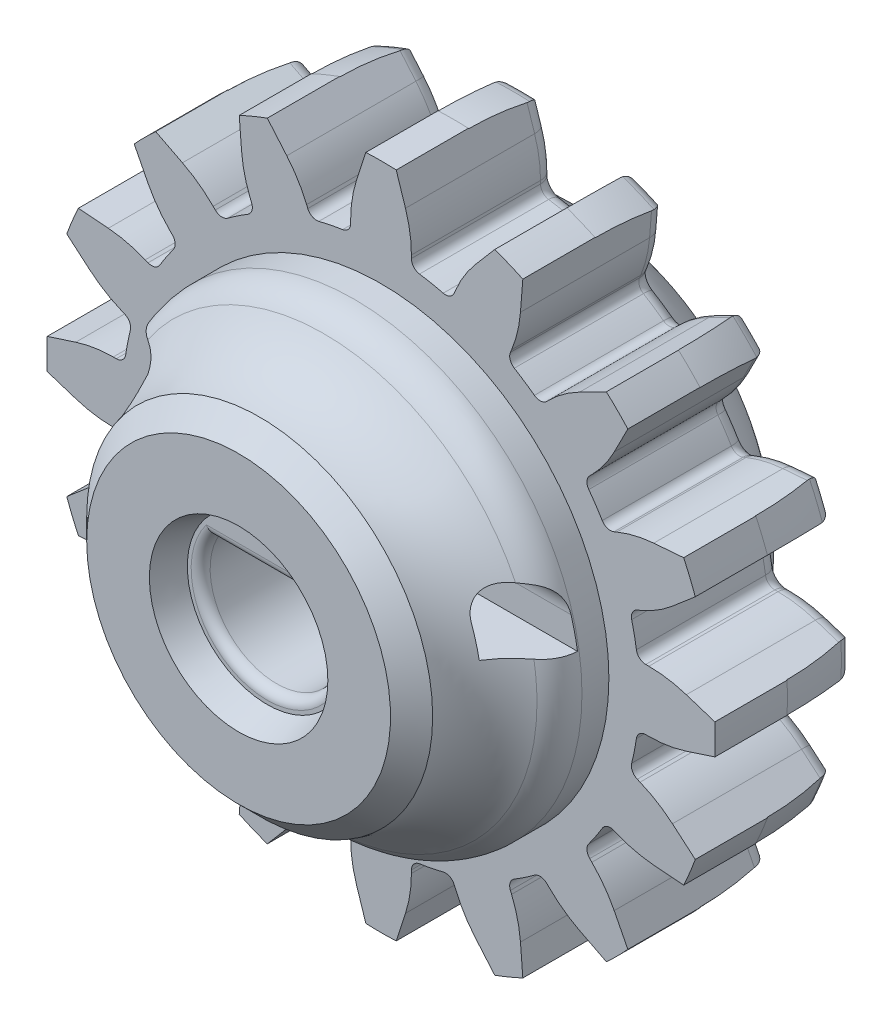
from build123d import *

# Parameters (mm, degrees)
BOSS_EXTRUDE1_DEPTH      = 3.8
BOSS_EXTRUDE2_DEPTH      = 3.8
FILLET1_R                = 3.2
FILLET2_R                = 0.25
CIRPATTERN1_COUNT        = 16
FILLET1_OF_CIRPATTERN1_R = 3.2
FILLET2_OF_CIRPATTERN1_R = 0.25
FILLET3_R                = 1
CUT_EXTRUDE1_DEPTH       = 14.837720232
CUT_EXTRUDE1_DEPTH_BACK  = 14.837720232
FILLET4_R                = 0.25
CUT_EXTRUDE2_DEPTH       = 14.837720232
CUT_EXTRUDE2_DEPTH_BACK  = 14.837720232
CUT_EXTRUDE3_START       = -4
SKETCH9_R                = 1.45
CUT_EXTRUDE3_DEPTH       = 10.837720232
CHAMFER2_SIZE2           = 0.25
CHAMFER2_SIZE            = 0.75
CHAMFER3_SIZE            = 0.5
FILLET5_R                = 0.4


# Some blends are built 0.0001 mm under size
with BuildPart() as part:
    # Sketch1 → Boss-Extrude1 (new body)
    with BuildSketch(Plane.XY):
        with BuildLine():
            Line((0, 0), (6.8, 0))
            ThreePointArc((6.8, 0), (4.808326112, 4.808326112), (0, 6.8))
            Line((0, 6.8), (0, 0))
        make_face()
    extrude(amount=-BOSS_EXTRUDE1_DEPTH)

    # Mirror1: part across plane


with BuildPart() as part_1:
    add(part.part)
    add(part.part.mirror(Plane.ZX))

    # Mirror2: part across plane


with BuildPart() as part_2:
    add(part_1.part)
    add(part_1.part.mirror(Plane(origin=(0, 0, 0), x_dir=(0, 0, 1), z_dir=(1, 0, 0))))

    # Sketch4 → Boss-Extrude2 (add)
    with BuildSketch(Plane.XY):
        with BuildLine():
            Line((-0.4, 8.79090439), (-0.8, 7.557777451))
            Line((-0.8, 7.557777451), (-0.8, 6.752777206))
            ThreePointArc((-0.8, 6.752777206), (0, 6.8), (0.8, 6.752777206))
            Line((0.8, 6.752777206), (0.8, 7.557777451))
            Line((0.8, 7.557777451), (0.4, 8.79090439))
            ThreePointArc((0.4, 8.79090439), (0, 8.8), (-0.4, 8.79090439))
        make_face()
    boss_extrude2 = extrude(amount=-BOSS_EXTRUDE2_DEPTH)

    # Fillet1
    fillet1_edges = [part_2.edges().sort_by_distance(p)[0] for p in [
        (0.8, 7.557777451, -1.9),
        (-0.8, 7.557777451, -1.9),
    ]]
    fillet(fillet1_edges, radius=FILLET1_R)

    # Fillet2
    fillet2_edges = [part_2.edges().sort_by_distance(p)[0] for p in [
        (0.8, 6.752777206, -1.9),
        (-0.8, 6.752777206, -1.9),
    ]]
    fillet(fillet2_edges, radius=FILLET2_R)

    # CirPattern1: Boss-Extrude2 ×16 about axis
    cirpattern1_axis = Axis((0, 0, 0), (0, 0, 1))
    for i in range(1, CIRPATTERN1_COUNT):
        add(boss_extrude2.rotate(cirpattern1_axis, i * 360 / CIRPATTERN1_COUNT))

    # Fillet1 of CirPattern1
    fillet1_of_cirpattern1_edges = [part_2.edges().sort_by_distance(p)[0] for p in [
        (-2.15313259, 7.288622644, -1.9),
        (-3.631339842, 6.676329152, -1.9),
        (-4.778470261, 5.909841111, -1.9),
        (-5.909841111, 4.778470261, -1.9),
        (-6.676329152, 3.631339842, -1.9),
        (-7.288622644, 2.15313259, -1.9),
        (-7.557777451, 0.8, -1.9),
        (-7.557777451, -0.8, -1.9),
        (-7.288622644, -2.15313259, -1.9),
        (-6.676329152, -3.631339842, -1.9),
        (-5.909841111, -4.778470261, -1.9),
        (-4.778470261, -5.909841111, -1.9),
        (-3.631339842, -6.676329152, -1.9),
        (-2.15313259, -7.288622644, -1.9),
        (-0.8, -7.557777451, -1.9),
        (0.8, -7.557777451, -1.9),
        (2.15313259, -7.288622644, -1.9),
        (3.631339842, -6.676329152, -1.9),
        (4.778470261, -5.909841111, -1.9),
        (5.909841111, -4.778470261, -1.9),
        (6.676329152, -3.631339842, -1.9),
        (7.288622644, -2.15313259, -1.9),
        (7.557777451, -0.8, -1.9),
        (7.557777451, 0.8, -1.9),
        (7.288622644, 2.15313259, -1.9),
        (6.676329152, 3.631339842, -1.9),
        (5.909841111, 4.778470261, -1.9),
        (4.778470261, 5.909841111, -1.9),
        (3.631339842, 6.676329152, -1.9),
        (2.15313259, 7.288622644, -1.9),
    ]]
    fillet(fillet1_of_cirpattern1_edges, radius=FILLET1_OF_CIRPATTERN1_R)

    # Fillet2 of CirPattern1
    fillet2_of_cirpattern1_edges = [part_2.edges().sort_by_distance(p)[0] for p in [
        (-1.845072333, 6.544899395, -1.9),
        (-3.323279585, 5.932605903, -1.9),
        (-4.20924913, 5.340619979, -1.9),
        (-5.340619979, 4.20924913, -1.9),
        (-5.932605903, 3.323279585, -1.9),
        (-6.544899395, 1.845072333, -1.9),
        (-6.752777206, 0.8, -1.9),
        (-6.752777206, -0.8, -1.9),
        (-6.544899395, -1.845072333, -1.9),
        (-5.932605903, -3.323279585, -1.9),
        (-5.340619979, -4.20924913, -1.9),
        (-4.20924913, -5.340619979, -1.9),
        (-3.323279585, -5.932605903, -1.9),
        (-1.845072333, -6.544899395, -1.9),
        (-0.8, -6.752777206, -1.9),
        (0.8, -6.752777206, -1.9),
        (1.845072333, -6.544899395, -1.9),
        (3.323279585, -5.932605903, -1.9),
        (4.20924913, -5.340619979, -1.9),
        (5.340619979, -4.20924913, -1.9),
        (5.932605903, -3.323279585, -1.9),
        (6.544899395, -1.845072333, -1.9),
        (6.752777206, -0.8, -1.9),
        (6.752777206, 0.8, -1.9),
        (6.544899395, 1.845072333, -1.9),
        (5.932605903, 3.323279585, -1.9),
        (5.340619979, 4.20924913, -1.9),
        (4.20924913, 5.340619979, -1.9),
        (3.323279585, 5.932605903, -1.9),
        (1.845072333, 6.544899395, -1.9),
    ]]
    fillet(fillet2_of_cirpattern1_edges, radius=FILLET2_OF_CIRPATTERN1_R)

    # Sketch5 → Revolve1 (revolve)
    with BuildSketch(Plane(origin=(0, 0, 0), x_dir=(0, 0, -1), z_dir=(1, 0, 0)), mode=Mode.PRIVATE) as revolve1_sk:
        with BuildLine():
            Line((-3, 0), (0, 0))
            Line((0, 0), (0, 6))
            Line((0, 6), (-1.25, 6))
            ThreePointArc((-1.25, 6), (-2.292262026, 4.903770044), (-3.75, 4.5))
            Line((-3.75, 4.5), (-3.75, 2.1))
            Line((-3.75, 2.1), (-3, 2.1))
            Line((-3, 2.1), (-3, 0))
        make_face()
    revolve(revolve1_sk.sketch.rotate(Axis((0, 0, -12.151543332), (0, 0, 1)), 270), axis=Axis((0, 0, -12.151543332), (0, 0, 1)))

    # Sketch11 → Revolve2 (revolve)
    with BuildSketch(Plane(origin=(0, 0, 0), x_dir=(0, 0, -1), z_dir=(1, 0, 0)), mode=Mode.PRIVATE) as revolve2_sk:
        with BuildLine():
            Line((0, 0), (6.05, 0))
            Line((6.05, 0), (6.05, 3))
            ThreePointArc((6.05, 3), (5.425, 4.875), (3.8, 6))
            Line((3.8, 6), (0, 0))
        make_face()
    revolve(revolve2_sk.sketch.rotate(Axis((0, 0, -12.151543332), (0, 0, 1)), 90), axis=Axis((0, 0, -12.151543332), (0, 0, 1)))

    # Fillet3
    fillet3_edges = [part_2.edges().sort_by_distance(p)[0] for p in [
        (-6, 0, 1.25),
    ]]
    fillet(fillet3_edges, radius=FILLET3_R)

    # Sketch6 → Cut-Extrude1 (cut, two sides: drawn at the far end of the back side and taken through both)
    with BuildSketch(Plane.XY.offset(-CUT_EXTRUDE1_DEPTH_BACK)):
        with BuildLine():
            Line((1.469693846, 0.95), (-1.469693846, 0.95))
            ThreePointArc((-1.469693846, 0.95), (0, -1.75), (1.469693846, 0.95))
        make_face()
    extrude(amount=CUT_EXTRUDE1_DEPTH + CUT_EXTRUDE1_DEPTH_BACK, mode=Mode.SUBTRACT)

    # Fillet4
    fillet4_edges = [part_2.edges().sort_by_distance(p)[0] for p in [
        (0, -1.75, 3),
        (0, 0.95, 3),
    ]]
    fillet(fillet4_edges, radius=FILLET4_R)

    # Sketch7 → Cut-Extrude2 (cut, two sides: drawn at the far end of the back side and taken through both)
    with BuildSketch(Plane(origin=(0, 0, 0), x_dir=(0, 0, -1), z_dir=(1, 0, 0)).offset(-CUT_EXTRUDE2_DEPTH_BACK)):
        with BuildLine():
            Line((-0.75, 1.7), (-0.75, 0.95))
            Line((-0.75, 0.95), (-2.25, 0.95))
            Line((-2.25, 0.95), (-2.25, 1.7))
            ThreePointArc((-2.25, 1.7), (-1.5, 2.45), (-0.75, 1.7))
        make_face()
    extrude(amount=CUT_EXTRUDE2_DEPTH + CUT_EXTRUDE2_DEPTH_BACK, mode=Mode.SUBTRACT)

    # Sketch9 → Cut-Extrude3 (cut, through all)
    with BuildSketch(Plane(origin=(0, 0, 0), x_dir=(0, 0, -1), z_dir=(1, 0, 0)).offset(CUT_EXTRUDE3_START)):
        with Locations((-1.5, 1.7)):
            Circle(SKETCH9_R)
    extrude(amount=-CUT_EXTRUDE3_DEPTH, mode=Mode.SUBTRACT)

    # Sketch12 → Cut-Revolve1 (revolve, cut)
    with BuildSketch(Plane(origin=(0, 0, 0), x_dir=(0, 0, -1), z_dir=(1, 0, 0)), mode=Mode.PRIVATE) as cut_revolve1_sk:
        with BuildLine():
            Line((1.9, 8.79090439), (1.9, 11.139921613))
            Line((1.9, 11.139921613), (10.69090439, 11.139921613))
            Line((10.69090439, 11.139921613), (10.69090439, 3.671626737))
            Line((10.69090439, 3.671626737), (9.857568987, 3.735919676))
            ThreePointArc((9.857568987, 3.735919676), (6.613697451, 7.420313763), (1.9, 8.79090439))
        make_face()
    revolve(cut_revolve1_sk.sketch.rotate(Axis((0, 0, -12.151543332), (0, 0, 1)), 90), axis=Axis((0, 0, -12.151543332), (0, 0, 1)), mode=Mode.SUBTRACT)

    # Chamfer2
    chamfer2_edges = [part_2.edges().sort_by_distance(p)[0] for p in [
        (-2.1, 0, 3.75),
    ]]
    chamfer2_side = [part_2.faces().sort_by_distance(p)[0] for p in [
        (-2.1, 0, 3.745),
    ]]
    chamfer(chamfer2_edges, length=CHAMFER2_SIZE - 0.0001, length2=CHAMFER2_SIZE2 - 0.0001, reference=chamfer2_side[0])  # a hair under: the kernel refuses the full size

    # Chamfer3
    # the kernel refuses this chamfer: 0.5 mm, written as the material it takes off along each edge
    with BuildSketch(Plane(origin=(0, 0, 3.75), x_dir=(1, 0, 0), z_dir=(0, -1, 0))) as chamfer3_piece_1:
        with BuildLine():
            Line((4.5 - CHAMFER3_SIZE, 0), (4.554861328, -0.554861328))
            ThreePointArc((4.554861328, -0.554861328), (4.514525604, -0.286532309), (4.5, 0))
            Line((4.5, 0), (4.5 - CHAMFER3_SIZE, 0))
        make_face()
    revolve(axis=Axis((0, 0, 3.75), (0, 0, 1)), mode=Mode.SUBTRACT)

    # Fillet5
    fillet5_edges = [part_2.edges().sort_by_distance(p)[0] for p in [
        (3.28461896, 7.929771641, -3.8),
        (-3.422311488, 6.171690064, -3.8),
        (-2.6627664, 7.88591896, -3.8),
        (-2.18704113, 7.267854878, -3.8),
        (-3.592677855, 6.685621083, -3.8),
        (-5.523607074, 4.392236225, -3.8),
        (-5.477885911, 6.266642537, -3.8),
        (-4.801850187, 5.877677961, -3.8),
        (-5.877677961, 4.801850187, -3.8),
        (-6.783983556, 1.944104236, -3.8),
        (-7.45904695, 3.693326595, -3.8),
        (-6.685621083, 3.592677855, -3.8),
        (-7.267854878, 2.18704113, -3.8),
        (-7.011560038, -0.8, -3.8),
        (-8.304635707, 0.557735158, -3.8),
        (-7.551566773, 0.760725114, -3.8),
        (-7.551566773, -0.760725114, -3.8),
        (-6.171690064, -3.422311488, -3.8),
        (-7.88591896, -2.6627664, -3.8),
        (-7.267854878, -2.18704113, -3.8),
        (-6.685621083, -3.592677855, -3.8),
        (-4.392236225, -5.523607074, -3.8),
        (-6.266642537, -5.477885911, -3.8),
        (-5.877677961, -4.801850187, -3.8),
        (-4.801850187, -5.877677961, -3.8),
        (-1.944104236, -6.783983556, -3.8),
        (-3.693326595, -7.45904695, -3.8),
        (-3.592677855, -6.685621083, -3.8),
        (-2.18704113, -7.267854878, -3.8),
        (0.8, -7.011560038, -3.8),
        (-0.557735158, -8.304635707, -3.8),
        (-0.760725114, -7.551566773, -3.8),
        (0.760725114, -7.551566773, -3.8),
        (3.422311488, -6.171690064, -3.8),
        (2.6627664, -7.88591896, -3.8),
        (2.18704113, -7.267854878, -3.8),
        (3.592677855, -6.685621083, -3.8),
        (5.523607074, -4.392236225, -3.8),
        (5.477885911, -6.266642537, -3.8),
        (4.801850187, -5.877677961, -3.8),
        (5.877677961, -4.801850187, -3.8),
        (-0.8, 7.011560038, -3.8),
        (6.783983556, -1.944104236, -3.8),
        (7.45904695, -3.693326595, -3.8),
        (6.685621083, -3.592677855, -3.8),
        (7.267854878, -2.18704113, -3.8),
        (0.557735158, 8.304635707, -3.8),
        (0.760725114, 7.551566773, -3.8),
        (7.011560038, 0.8, -3.8),
        (-0.760725114, 7.551566773, -3.8),
        (8.304635707, -0.557735158, -3.8),
        (7.551566773, -0.760725114, -3.8),
        (7.551566773, 0.760725114, -3.8),
        (6.171690064, 3.422311488, -3.8),
        (7.88591896, 2.6627664, -3.8),
        (7.267854878, 2.18704113, -3.8),
        (6.685621083, 3.592677855, -3.8),
        (4.392236225, 5.523607074, -3.8),
        (6.266642537, 5.477885911, -3.8),
        (5.877677961, 4.801850187, -3.8),
        (4.801850187, 5.877677961, -3.8),
        (1.944104236, 6.783983556, -3.8),
        (3.693326595, 7.45904695, -3.8),
        (3.592677855, 6.685621083, -3.8),
        (2.18704113, 7.267854878, -3.8),
        (-1.944104236, 6.783983556, -3.8),
        (-3.777877585, 5.653993364, -3.8),
        (-1.810406071, 6.619343086, -3.8),
        (-3.400431974, 5.960732792, -3.8),
        (-4.392236225, 5.523607074, -3.8),
        (-5.653993364, 3.777877585, -3.8),
        (-4.205710046, 5.422663187, -3.8),
        (-5.422663187, 4.205710046, -3.8),
        (-6.171690064, 3.422311488, -3.8),
        (-6.669339907, 1.32661419, -3.8),
        (-1.32661419, 6.669339907, -3.8),
        (-5.960732792, 3.400431974, -3.8),
        (-6.619343086, 1.810406071, -3.8),
        (-7.011560038, 0.8, -3.8),
        (-6.669339907, -1.32661419, -3.8),
        (-6.808288005, 0.860515818, -3.8),
        (-6.808288005, -0.860515818, -3.8),
        (0.8, 7.011560038, -3.8),
        (-6.783983556, -1.944104236, -3.8),
        (-5.653993364, -3.777877585, -3.8),
        (-6.619343086, -1.810406071, -3.8),
        (-5.960732792, -3.400431974, -3.8),
        (-5.523607074, -4.392236225, -3.8),
        (-3.777877585, -5.653993364, -3.8),
        (0.860515818, 6.808288005, -3.8),
        (-5.422663187, -4.205710046, -3.8),
        (-4.205710046, -5.422663187, -3.8),
        (-3.422311488, -6.171690064, -3.8),
        (-0.860515818, 6.808288005, -3.8),
        (-1.32661419, -6.669339907, -3.8),
        (-3.400431974, -5.960732792, -3.8),
        (-1.810406071, -6.619343086, -3.8),
        (-0.8, -7.011560038, -3.8),
        (1.32661419, -6.669339907, -3.8),
        (-0.860515818, -6.808288005, -3.8),
        (0.860515818, -6.808288005, -3.8),
        (1.944104236, -6.783983556, -3.8),
        (3.777877585, -5.653993364, -3.8),
        (1.810406071, -6.619343086, -3.8),
        (3.400431974, -5.960732792, -3.8),
        (4.392236225, -5.523607074, -3.8),
        (5.653993364, -3.777877585, -3.8),
        (4.205710046, -5.422663187, -3.8),
        (5.422663187, -4.205710046, -3.8),
        (6.171690064, -3.422311488, -3.8),
        (6.669339907, -1.32661419, -3.8),
        (5.960732792, -3.400431974, -3.8),
        (6.619343086, -1.810406071, -3.8),
        (7.011560038, -0.8, -3.8),
        (6.669339907, 1.32661419, -3.8),
        (6.808288005, -0.860515818, -3.8),
        (6.808288005, 0.860515818, -3.8),
        (6.783983556, 1.944104236, -3.8),
        (5.653993364, 3.777877585, -3.8),
        (6.619343086, 1.810406071, -3.8),
        (5.960732792, 3.400431974, -3.8),
        (5.523607074, 4.392236225, -3.8),
        (3.777877585, 5.653993364, -3.8),
        (5.422663187, 4.205710046, -3.8),
        (4.205710046, 5.422663187, -3.8),
        (3.422311488, 6.171690064, -3.8),
        (1.32661419, 6.669339907, -3.8),
        (3.400431974, 5.960732792, -3.8),
        (1.810406071, 6.619343086, -3.8),
        (6, 0, -3.8),
        (2.6627664, 7.88591896, -3.8),
        (5.477885911, 6.266642537, -3.8),
        (7.45904695, 3.693326595, -3.8),
        (8.304635707, 0.557735158, -3.8),
        (7.88591896, -2.6627664, -3.8),
        (6.266642537, -5.477885911, -3.8),
        (3.693326595, -7.45904695, -3.8),
        (0.557735158, -8.304635707, -3.8),
        (-2.6627664, -7.88591896, -3.8),
        (-5.477885911, -6.266642537, -3.8),
        (-7.45904695, -3.693326595, -3.8),
        (-8.304635707, -0.557735158, -3.8),
        (-7.88591896, 2.6627664, -3.8),
        (-6.266642537, 5.477885911, -3.8),
        (-3.693326595, 7.45904695, -3.8),
        (-0.557735158, 8.304635707, -3.8),
        (0, 8.583122975, -3.8),
        (-3.28461896, 7.929771641, -3.8),
        (-6.069184459, 6.069184459, -3.8),
        (-7.929771641, 3.28461896, -3.8),
        (-8.583122975, 0, -3.8),
        (-7.929771641, -3.28461896, -3.8),
        (-6.069184459, -6.069184459, -3.8),
        (-3.28461896, -7.929771641, -3.8),
        (0, -8.583122975, -3.8),
        (3.28461896, -7.929771641, -3.8),
        (6.069184459, -6.069184459, -3.8),
        (7.929771641, -3.28461896, -3.8),
        (8.583122975, 0, -3.8),
        (7.929771641, 3.28461896, -3.8),
        (6.069184459, 6.069184459, -3.8),
    ]]
    fillet(fillet5_edges, radius=FILLET5_R)


solid = part_2.part
